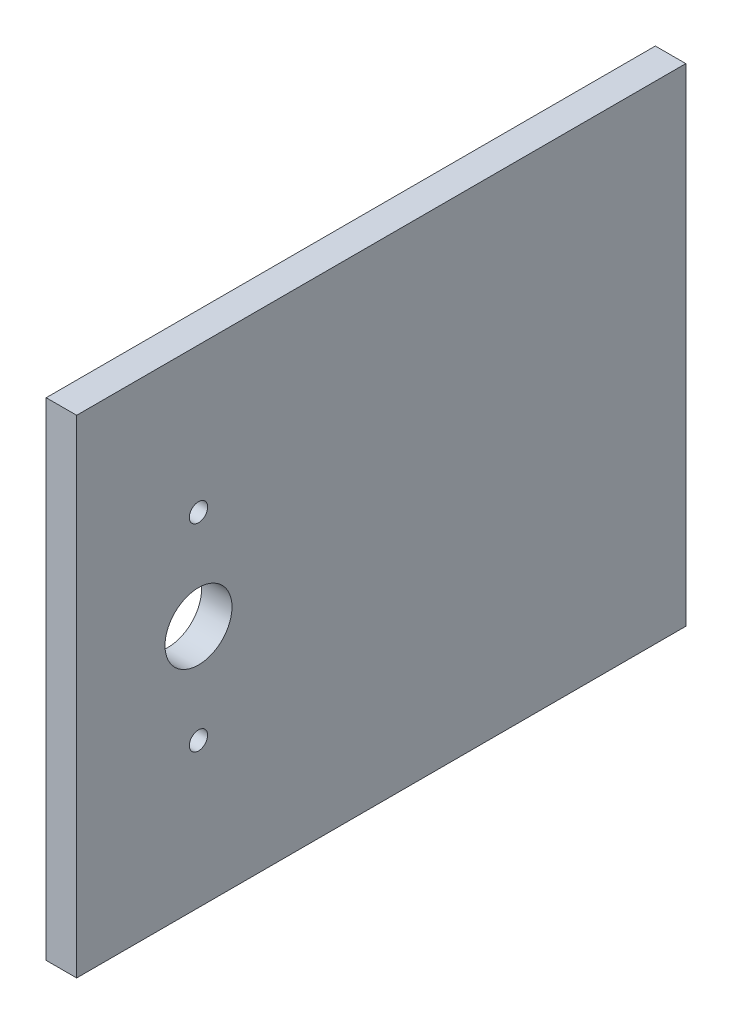
from build123d import *

# Parameters (mm, degrees)
SKETCH1_W           = 80
SKETCH1_H           = 100
SKETCH1_R           = 5.5
SKETCH1_R_2         = 1.5
BOSS_EXTRUDE1_DEPTH = 5


with BuildPart() as part:
    # Sketch1 → Boss-Extrude1 (new body)
    with BuildSketch(Plane.YZ):
        Rectangle(SKETCH1_W, SKETCH1_H)
        with Locations((0, 30)):
            Circle(SKETCH1_R, mode=Mode.SUBTRACT)
        with Locations((-16.22, 30)):
            Circle(SKETCH1_R_2, mode=Mode.SUBTRACT)
        with Locations((16.22, 30)):
            Circle(SKETCH1_R_2, mode=Mode.SUBTRACT)
    extrude(amount=BOSS_EXTRUDE1_DEPTH)


solid = part.part
